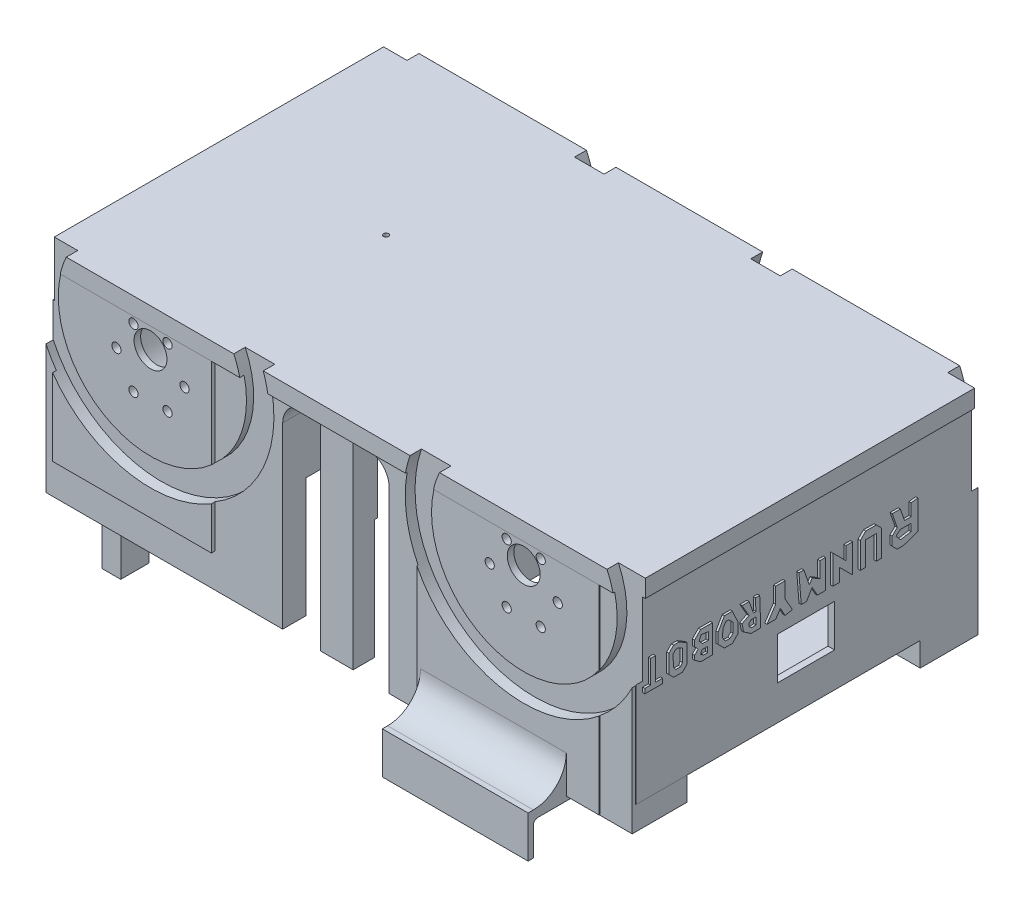
from build123d import *

# Parameters (mm, degrees)
MOTORHOLDERS_DEPTH            = 80
MOTORHOLDERS_DEPTH_BACK       = 80
MOTORHOLDERSSKETCH_R          = 23.41
MOTORHOLDERS_2_DEPTH          = 80
MOTORHOLDERS_2_DEPTH_BACK     = 80
MOTORHOLDERSSKETCH_R_2        = 23.410000000000025
CUT_EXTRUDE1_DEPTH            = 26
POWERBANKHOLDERS_DEPTH        = 40
POWERBANKHOLDERS_DEPTH_BACK   = 59
SKETCH6_W                     = 107.48566634907709
SKETCH6_H                     = 13.420779118391124
SKETCH6_W_2                   = 20.81020685105895
SKETCH6_H_2                   = 2.0210586418158982
POWERBANKHOLDERS_2_DEPTH      = 40
POWERBANKHOLDERS_2_DEPTH_BACK = 59
SKETCH6_W_3                   = 107.81575088950635
SKETCH6_H_3                   = 38.261259505880204
SKETCH6_W_4                   = 10.842850570790063
SKETCH6_H_4                   = 10.34767934655001
POWERBANKHOLDERS_3_DEPTH      = 40
POWERBANKHOLDERS_3_DEPTH_BACK = 59
SKETCH6_W_5                   = 12.84432880492869
SKETCH6_H_5                   = 18.336479725004295
SKETCH6_W_6                   = 4.801433035453329
SKETCH6_H_6                   = 16.44346118779616
POWERBANKHOLDERS_4_DEPTH      = 40
POWERBANKHOLDERS_4_DEPTH_BACK = 59
SKETCH6_W_7                   = 11.134493860227579
SKETCH6_H_7                   = 18.035399163150785
POWERBANKHOLDERS_5_DEPTH      = 40
POWERBANKHOLDERS_5_DEPTH_BACK = 59
SKETCH6_W_8                   = 17.76333338604985
SKETCH6_H_8                   = 11.185766025079147
POWERBANKHOLDERS_6_DEPTH      = 40
POWERBANKHOLDERS_6_DEPTH_BACK = 59
SKETCH6_W_9                   = 14.81192900930138
SKETCH6_H_9                   = 11.030658463431195
POWERBANKHOLDERS_7_DEPTH      = 40
POWERBANKHOLDERS_7_DEPTH_BACK = 59
SKETCH6_W_10                  = 28.15049543841664
SKETCH6_H_10                  = 24.933985152667752
SKETCH6_W_11                  = 10.177859406913743
SKETCH6_H_11                  = 9.830705690674797
POWERBANKHOLDERS_8_DEPTH      = 40
POWERBANKHOLDERS_8_DEPTH_BACK = 59
SKETCH6_W_12                  = 9.898416254173764
SKETCH6_H_12                  = 10.635603546202077
BOTTOMPLATE_DEPTH             = 5
BOTTOMPLATE_DEPTH_BACK        = 3
SKETCH21_R                    = 156.39530567461404
SKETCH23_W                    = 82.93611580154447
SKETCH23_H                    = 96.21116390792395
MOTORMOUNTINGSUPPORT1_DEPTH   = 6
SKETCH24_W                    = 78.34199480159754
SKETCH24_H                    = 94.4397113557649
MOTORMOUNTINGSUPPOR2_DEPTH    = 6
SKETCH17_R                    = 2.09999999999999
SKETCH17_R_2                  = 7.500000000000012
MOTORHOLES1_DEPTH             = 31.5
SKETCH19_R                    = 2.09999999999999
SKETCH19_R_2                  = 7.500000000000012
CUT_EXTRUDE4_DEPTH            = 30
BOLTHOLESSKETCH3_R            = 2.099999999999999
BOLTHOLESSKETCH3_R_2          = 2.1000000000000005
BOLTHOLESSKETCH3_R_3          = 2.100000000000001
BOLTHOLESSKETCH3_R_4          = 2.1
BOLTHOLESSKETCH3_R_5          = 7.5
MOTORHOLES3_DEPTH             = 31.5
BOLTHOLESSKETCH4_R            = 2.1000000000000005
BOLTHOLESSKETCH4_R_2          = 2.100000000000001
BOLTHOLESSKETCH4_R_3          = 2.099999999999999
BOLTHOLESSKETCH4_R_4          = 2.1
BOLTHOLESSKETCH4_R_5          = 7.5
MOTORHOLES4_DEPTH             = 15
SKETCH29_W                    = 154.63520503595873
SKETCH29_H                    = 84.13158809310062
SKETCH29_W_2                  = 25.999999999999996
SKETCH29_H_2                  = 19.212652327723852
BOSS_EXTRUDE8_DEPTH           = 3
SKETCH27_W                    = 226.46009321955773
SKETCH27_H                    = 129.98521171532218
BOSS_EXTRUDE6_DEPTH           = 3
CELLPHONEPLATE_DEPTH          = 1.5
CELLPHONEPLATE_DEPTH_BACK     = 2.5
SKETCH28_W                    = 66.38711597502933
SKETCH28_H                    = 194.1164695368904
SKETCH40_W                    = 33.84157761105802
SKETCH40_H                    = 31.531825245394884
BOSS_EXTRUDE11_DEPTH          = 40.00000000000001
FILLET2_R                     = 15
FILLET3_R                     = 15
POWERBANKCUT_START            = -54.404272
POWERBANKCUT_DEPTH            = 54.404272
MOTORHOLDERCUT_DEPTH          = 77
MOTORHOLDERCUT_DEPTH_BACK     = 77
MOTORHOLDEREXTRUDESKETCH_R    = 20.414999999999996
MOTORHOLDEREXTRUDESKETCH_R_2  = 20.415
LABEL_DEPTH                   = 1
BASEDEFININGCUT_DEPTH         = 20
BASEDEFININGCUT_DEPTH_BACK    = 20
SKETCH32_W                    = 420.0455690375122
SKETCH32_H                    = 425.0465275567352
SKETCH32_W_2                  = 269.20567079458385
SKETCH32_H_2                  = 160.6451255561545
SKETCH36_R                    = 7.790164170832256
CUT_EXTRUDE6_DEPTH            = 40
SKETCH37_W                    = 55.34013361119605
SKETCH37_H                    = 29.77089050035886
CUT_EXTRUDE7_DEPTH            = 36
SKETCH38_R                    = 1.1451827740932787
CUT_EXTRUDE8_DEPTH            = 10
SPACEFORWHEEL1_DEPTH          = 10
SPACEFORWHEEL1_DEPTH_BACK     = 5
SKETCH41_R                    = 54.50000000000001
SKETCH41_R_2                  = 42
CUT_EXTRUDE10_DEPTH           = 10
CUT_EXTRUDE10_DEPTH_BACK      = 5
SKETCH42_R                    = 54.5
SKETCH42_R_2                  = 42
CUT_EXTRUDE11_DEPTH           = 10
CUT_EXTRUDE11_DEPTH_BACK      = 5
SKETCH43_R                    = 54.5
SKETCH43_R_2                  = 42
CUT_EXTRUDE12_DEPTH           = 10
CUT_EXTRUDE12_DEPTH_BACK      = 5
SKETCH44_R                    = 54.50000000000001
SKETCH44_R_2                  = 42
SKETCH45_W                    = 114.13753960277973
SKETCH45_H                    = 142.1470000344427
BACKPLATE_DEPTH               = 2
FILLET4_R                     = 15
FILLET5_R                     = 15
SKETCH47_W                    = 66.38711597502933
SKETCH47_H                    = 3.2790129923405544
SKETCH47_H_2                  = 2.4323307430051813
BOSS_EXTRUDE14_DEPTH          = 15
FILLET6_R                     = 2
FILLET7_R                     = 2
FILLET8_R                     = 10
FILLET9_R                     = 10
FILLET10_R                    = 10
FILLET11_R                    = 10
SKETCH50_W                    = 8.545792847575534
SKETCH50_H                    = 12.7585898723055
SKETCH50_W_2                  = 13.708152170310989
SKETCH50_H_2                  = 12.203436132949719
BOSS_EXTRUDE15_DEPTH          = 42.74272791


with BuildPart() as part:
    # MotorHoldersSketch → MotorHolders (new, two sides: drawn at the far end of the back side and taken through both)
    with BuildSketch(Plane.XY.offset(-MOTORHOLDERS_DEPTH_BACK)):
        Circle(MOTORHOLDERSSKETCH_R)
    extrude(amount=MOTORHOLDERS_DEPTH + MOTORHOLDERS_DEPTH_BACK)


with BuildPart() as body_2:
    # MotorHoldersSketch → MotorHolders 2 (new, two sides: drawn at the far end of the back side and taken through both)
    with BuildSketch(Plane.XY.offset(-MOTORHOLDERS_2_DEPTH_BACK)):
        with Locations((170, 0)):
            Circle(MOTORHOLDERSSKETCH_R_2)
    extrude(amount=MOTORHOLDERS_2_DEPTH + MOTORHOLDERS_2_DEPTH_BACK)


with BuildPart() as cut_extrude1_tool:
    # Sketch4 → Cut-Extrude1 (new body)
    with BuildSketch(Plane(origin=(0, 0, 0), x_dir=(1, 0, 0), z_dir=(0, 1, 0))):
        Polygon((221.28112037560754, -76.3794444337611), (-41.49386299775418, -76.37944443376111), (-41.49386299775418, 76.73310878075944), (221.28112037560754, 76.73310878075947), align=None)
    extrude(amount=-CUT_EXTRUDE1_DEPTH)


with BuildPart() as part_1:
    add(part.part)

    # Cut-Extrude1: cut by cut_extrude1_tool
    add(cut_extrude1_tool.part, mode=Mode.SUBTRACT)


with BuildPart() as body_2_1:
    add(body_2.part)

    # Cut-Extrude1: cut by cut_extrude1_tool
    add(cut_extrude1_tool.part, mode=Mode.SUBTRACT)


with BuildPart() as body_3:
    # Sketch6 → PowerBankHolders (new, two sides: drawn at the far end of the back side and taken through both)
    with BuildSketch(Plane(origin=(170, -34.82927212472651, 0), x_dir=(-1, 0, 0), z_dir=(0, -1, 0)).offset(-POWERBANKHOLDERS_DEPTH_BACK)):
        with Locations((165.84301336448004, 72.23860239394497)):
            Rectangle(SKETCH6_W, SKETCH6_H)
        with Locations((203.359863581841, 72.02584001471735)):
            Rectangle(SKETCH6_W_2, SKETCH6_H_2, mode=Mode.SUBTRACT)
    extrude(amount=POWERBANKHOLDERS_DEPTH + POWERBANKHOLDERS_DEPTH_BACK)



with BuildPart() as body_4:
    # Sketch6 → PowerBankHolders 2 (new, two sides: drawn at the far end of the back side and taken through both)
    with BuildSketch(Plane(origin=(170, -34.82927212472651, 0), x_dir=(-1, 0, 0), z_dir=(0, -1, 0)).offset(-POWERBANKHOLDERS_2_DEPTH_BACK)):
        with Locations((165.40685205589546, -59.15152226882369)):
            Rectangle(SKETCH6_W_3, SKETCH6_H_3)
        with Locations((206.51967237862002, -65.31428126840754)):
            Rectangle(SKETCH6_W_4, SKETCH6_H_4, mode=Mode.SUBTRACT)
    extrude(amount=POWERBANKHOLDERS_2_DEPTH + POWERBANKHOLDERS_2_DEPTH_BACK)


with BuildPart() as body_5:
    # Sketch6 → PowerBankHolders 3 (new, two sides: drawn at the far end of the back side and taken through both)
    with BuildSketch(Plane(origin=(170, -34.82927212472651, 0), x_dir=(-1, 0, 0), z_dir=(0, -1, 0)).offset(-POWERBANKHOLDERS_3_DEPTH_BACK)):
        Polygon((61.48912491997995, 77.86267405225546), (19.990361205501905, 77.86267405225546), (19.990361205501912, 40.75116664647993), (61.48912491997996, 40.75116664647993), align=None)
        with Locations((34.93306737058843, 60.0094908798372)):
            Rectangle(SKETCH6_W_5, SKETCH6_H_5, mode=Mode.SUBTRACT)
        with Locations((56.270377411507866, 59.54149533416331)):
            Rectangle(SKETCH6_W_6, SKETCH6_H_6, mode=Mode.SUBTRACT)
    extrude(amount=POWERBANKHOLDERS_3_DEPTH + POWERBANKHOLDERS_3_DEPTH_BACK)


with BuildPart() as body_6:
    # Sketch6 → PowerBankHolders 4 (new, two sides: drawn at the far end of the back side and taken through both)
    with BuildSketch(Plane(origin=(170, -34.82927212472651, 0), x_dir=(-1, 0, 0), z_dir=(0, -1, 0)).offset(-POWERBANKHOLDERS_4_DEPTH_BACK)):
        Polygon((61.848353672680666, -44.171562986971225), (20.085249497251212, -44.171562986971225), (20.08524949725122, -79.44365778120854), (61.84835367268067, -79.44365778120854), align=None)
        with Locations((37.739531579554786, -63.79239196585518)):
            Rectangle(SKETCH6_W_7, SKETCH6_H_7, mode=Mode.SUBTRACT)
        Polygon((56.36480368236718, -69.86379189792335), (51.71071499986879, -69.86379189792335), (51.71071499986879, -55.42725312023401), (56.36480368236718, -55.427253120234), align=None, mode=Mode.SUBTRACT)
    extrude(amount=POWERBANKHOLDERS_4_DEPTH + POWERBANKHOLDERS_4_DEPTH_BACK)


with BuildPart() as body_7:
    # Sketch6 → PowerBankHolders 5 (new, two sides: drawn at the far end of the back side and taken through both)
    with BuildSketch(Plane(origin=(170, -34.82927212472651, 0), x_dir=(-1, 0, 0), z_dir=(0, -1, 0)).offset(-POWERBANKHOLDERS_5_DEPTH_BACK)):
        with Locations((88.2978554425371, 73.35610894060096)):
            Rectangle(SKETCH6_W_8, SKETCH6_H_8)
    extrude(amount=POWERBANKHOLDERS_5_DEPTH + POWERBANKHOLDERS_5_DEPTH_BACK)


with BuildPart() as body_8:
    # Sketch6 → PowerBankHolders 6 (new, two sides: drawn at the far end of the back side and taken through both)
    with BuildSketch(Plane(origin=(170, -34.82927212472651, 0), x_dir=(-1, 0, 0), z_dir=(0, -1, 0)).offset(-POWERBANKHOLDERS_6_DEPTH_BACK)):
        with Locations((86.82215325416286, -72.7668227900482)):
            Rectangle(SKETCH6_W_9, SKETCH6_H_9)
    extrude(amount=POWERBANKHOLDERS_6_DEPTH + POWERBANKHOLDERS_6_DEPTH_BACK)


with BuildPart() as body_9:
    # Sketch6 → PowerBankHolders 7 (new, two sides: drawn at the far end of the back side and taken through both)
    with BuildSketch(Plane(origin=(170, -34.82927212472651, 0), x_dir=(-1, 0, 0), z_dir=(0, -1, 0)).offset(-POWERBANKHOLDERS_7_DEPTH_BACK)):
        with Locations((-34.77538877141884, -66.97666520487466)):
            Rectangle(SKETCH6_W_10, SKETCH6_H_10)
        with Locations((-36.725173704837744, -67.89473870209318)):
            Rectangle(SKETCH6_W_11, SKETCH6_H_11, mode=Mode.SUBTRACT)
    extrude(amount=POWERBANKHOLDERS_7_DEPTH + POWERBANKHOLDERS_7_DEPTH_BACK)


with BuildPart() as body_10:
    # Sketch6 → PowerBankHolders 8 (new, two sides: drawn at the far end of the back side and taken through both)
    with BuildSketch(Plane(origin=(170, -34.82927212472651, 0), x_dir=(-1, 0, 0), z_dir=(0, -1, 0)).offset(-POWERBANKHOLDERS_8_DEPTH_BACK)):
        Polygon((-18.387318432179, 77.86267405225546), (-49.058063184687306, 77.86267405225546), (-49.058063184687306, 51.53245449057575), (-18.387318432178997, 51.53245449057575), align=None)
        with Locations((-36.58545212846775, 63.85992896923831)):
            Rectangle(SKETCH6_W_12, SKETCH6_H_12, mode=Mode.SUBTRACT)
    extrude(amount=POWERBANKHOLDERS_8_DEPTH + POWERBANKHOLDERS_8_DEPTH_BACK)


with BuildPart() as body_3_1:
    add(body_3.part)

    add(body_4.part)  # BottomPlate merges body 4

    add(body_2_1.part)  # BottomPlate merges body 2

    add(part_1.part)  # BottomPlate merges part

    add(body_5.part)  # BottomPlate merges body 5

    add(body_6.part)  # BottomPlate merges body 6
    # Sketch21 → BottomPlate (add, two sides: drawn at the far end of the back side and taken through both)
    with BuildSketch(Plane(origin=(0, 19.57500000000001, 0), x_dir=(1, 0, 0), z_dir=(0, 1, 0)).offset(-BOTTOMPLATE_DEPTH_BACK)):
        with Locations(Location((85, 0, 0), (0, 0, 270))):
            Circle(SKETCH21_R)
    extrude(amount=BOTTOMPLATE_DEPTH + BOTTOMPLATE_DEPTH_BACK)


    add(body_9.part)  # MotorMountingSupport1 merges body 9
    # Sketch23 → MotorMountingSupport1 (add)
    with BuildSketch(Plane.XY.offset(80)):
        Polygon((27.741104921460646, -59.32285943157468), (-44.590126411037545, -59.32285943157469), (-44.590126411037545, 21.840194884099123), (27.741104921460646, 21.840194884099155), align=None)
        with Locations((162.78990640537927, -26.265387069862815)):
            Rectangle(SKETCH23_W, SKETCH23_H)
    extrude(amount=-MOTORMOUNTINGSUPPORT1_DEPTH)


    add(body_10.part)  # MotorMountingSuppor2 merges body 10
    # Sketch24 → MotorMountingSuppor2 (add)
    with BuildSketch(Plane(origin=(0, 0, -80), x_dir=(-1, 0, 0), z_dir=(0, 0, -1))):
        with Locations((-163.01952291155786, -27.98244879419265)):
            Rectangle(SKETCH24_W, SKETCH24_H)
        Polygon((-24.364188118497054, -64.15214262477775), (29.550487251242423, -64.15214262477775), (29.55048725124243, 22.52259734262907), (-24.364188118497054, 22.52259734262907), align=None)
    extrude(amount=-MOTORMOUNTINGSUPPOR2_DEPTH)

    # Sketch17 → MotorHoles1 (cut)
    with BuildSketch(Plane.XY.offset(80)):
        with Locations((185.5, 3.47e-15)):
            Circle(SKETCH17_R)
        with Locations((177.75000000000003, -13.42)):
            Circle(SKETCH17_R)
        with Locations((162.25, -13.420000000000002)):
            Circle(SKETCH17_R)
        with Locations((154.50000000000003, -9.5e-16)):
            Circle(SKETCH17_R)
        with Locations((162.25, 13.42)):
            Circle(SKETCH17_R)
        with Locations((177.75000000000003, 13.420000000000002)):
            Circle(SKETCH17_R)
        with Locations((170, 6.999999999999999)):
            Circle(SKETCH17_R_2)
    extrude(amount=-MOTORHOLES1_DEPTH, mode=Mode.SUBTRACT)

    # Sketch19 → Cut-Extrude4 (cut)
    with BuildSketch(Plane(origin=(0, 0, -80), x_dir=(-1, 0, 0), z_dir=(0, 0, -1))):
        with Locations(Location((-185.5, 3.47e-15, 0), (0, 0, 180))):
            Circle(SKETCH19_R)
        with Locations(Location((-177.75000000000003, -13.42, 0), (0, 0, 180))):
            Circle(SKETCH19_R)
        with Locations(Location((-162.25, -13.420000000000002, 0), (0, 0, 180))):
            Circle(SKETCH19_R)
        with Locations(Location((-154.50000000000003, -9.5e-16, 0), (0, 0, 180))):
            Circle(SKETCH19_R)
        with Locations(Location((-162.25, 13.42, 0), (0, 0, 180))):
            Circle(SKETCH19_R)
        with Locations(Location((-177.75000000000003, 13.420000000000002, 0), (0, 0, 180))):
            Circle(SKETCH19_R)
        with Locations(Location((-170, 6.999999999999999, 0), (0, 0, 180))):
            Circle(SKETCH19_R_2)
    extrude(amount=-CUT_EXTRUDE4_DEPTH, mode=Mode.SUBTRACT)

    # BoltHolesSketch3 → MotorHoles3 (cut)
    with BuildSketch(Plane.XY.offset(80)):
        with Locations((7.750000000000002, -13.419999999999996)):
            Circle(BOLTHOLESSKETCH3_R)
        with Locations((15.5, 9.5e-16)):
            Circle(BOLTHOLESSKETCH3_R_2)
        with Locations((7.75, 13.420000000000002)):
            Circle(BOLTHOLESSKETCH3_R_3)
        with Locations((-7.75, 13.419999999999996)):
            Circle(BOLTHOLESSKETCH3_R_4)
        with Locations((-15.5, -2.85e-15)):
            Circle(BOLTHOLESSKETCH3_R_2)
        with Locations((-7.749999999999998, -13.420000000000002)):
            Circle(BOLTHOLESSKETCH3_R_3)
        with Locations((0, 7.000000000000001)):
            Circle(BOLTHOLESSKETCH3_R_5)
    extrude(amount=-MOTORHOLES3_DEPTH, mode=Mode.SUBTRACT)

    # BoltHolesSketch4 → MotorHoles4 (cut)
    with BuildSketch(Plane(origin=(0, 0, -80), x_dir=(-1, 0, 0), z_dir=(0, 0, -1))):
        with Locations(Location((-15.5, 9.5e-16, 0), (0, 0, 180))):
            Circle(BOLTHOLESSKETCH4_R)
        with Locations(Location((-7.75, 13.420000000000002, 0), (0, 0, 180))):
            Circle(BOLTHOLESSKETCH4_R_2)
        with Locations(Location((7.75, 13.419999999999996, 0), (0, 0, 180))):
            Circle(BOLTHOLESSKETCH4_R_2)
        with Locations(Location((15.5, -2.85e-15, 0), (0, 0, 180))):
            Circle(BOLTHOLESSKETCH4_R)
        with Locations(Location((7.749999999999998, -13.420000000000002, 0), (0, 0, 180))):
            Circle(BOLTHOLESSKETCH4_R_3)
        with Locations(Location((-7.750000000000002, -13.419999999999996, 0), (0, 0, 180))):
            Circle(BOLTHOLESSKETCH4_R_4)
        with Locations(Location((0, 7.000000000000001, 0), (0, 0, 180))):
            Circle(BOLTHOLESSKETCH4_R_5)
    extrude(amount=-MOTORHOLES4_DEPTH, mode=Mode.SUBTRACT)

    # Sketch29 → Boss-Extrude8 (add)
    with BuildSketch(Plane(origin=(219.0580631846873, 0, 0), x_dir=(0, 0, -1), z_dir=(1, 0, 0))):
        with Locations((-0.6220853119600633, -21.859578751275425)):
            Rectangle(SKETCH29_W, SKETCH29_H)
        with Locations((-0.4507126701493025, -38.546737855057245)):
            Rectangle(SKETCH29_W_2, SKETCH29_H_2, mode=Mode.SUBTRACT)
    extrude(amount=-BOSS_EXTRUDE8_DEPTH)

    # Sketch27 → Boss-Extrude6 (add)
    with BuildSketch(Plane(origin=(0, 16.57500000000001, 0), x_dir=(-1, 0, 0), z_dir=(0, -1, 0))):
        with Locations((-81.59637652194363, -0.4409200767696575)):
            Rectangle(SKETCH27_W, SKETCH27_H)
    extrude(amount=-BOSS_EXTRUDE6_DEPTH)

    # Sketch28 → CellPhonePlate (add, two sides: drawn at the far end of the back side and taken through both)
    with BuildSketch(Plane(origin=(0, -74.82927212472651, 0), x_dir=(-1, 0, 0), z_dir=(0, -1, 0)).offset(-CELLPHONEPLATE_DEPTH_BACK)):
        with Locations((-156.1961547289368, -0.33906712376997206)):
            Rectangle(SKETCH28_W, SKETCH28_H)
    extrude(amount=CELLPHONEPLATE_DEPTH + CELLPHONEPLATE_DEPTH_BACK)

    # Sketch40 → Boss-Extrude11 (add)
    with BuildSketch(Plane.XZ.offset(-16.57500000000001)):
        with Locations((-32.665057733489554, -49.76230021205197)):
            Rectangle(SKETCH40_W, SKETCH40_H)
    extrude(amount=BOSS_EXTRUDE11_DEPTH)

    # Fillet2
    fillet2_edges = [body_3_1.edges().sort_by_distance(p)[0] for p in [
        (-33.058778866481674, 16.57500000000001, -33.996387589354526),
    ]]
    fillet(fillet2_edges, radius=FILLET2_R)

    # Fillet3
    fillet3_edges = [body_3_1.edges().sort_by_distance(p)[0] for p in [
        (-32.66505773348956, -23.424999999999997, -65.52821283474941),
    ]]
    fillet(fillet3_edges, radius=FILLET3_R)


with BuildPart() as powerbankcut_tool:
    # Sketch11 → PowerBankCut (new body)
    with BuildSketch(Plane(origin=(0, -20.42499999999999, 0), x_dir=(1, 0, 0), z_dir=(0, 1, 0)).offset(POWERBANKCUT_START)):
        Polygon((-34.21619001805881, -64.75806101125161), (-34.21619001805884, 73.34245994628247), (204.21619001805877, 63.61100877966222), (204.2161900180588, -72.19540771469299), align=None)
    extrude(amount=POWERBANKCUT_DEPTH)


with BuildPart() as body_3_2:
    add(body_3_1.part)

    # PowerBankCut: cut by powerbankcut_tool
    add(powerbankcut_tool.part, mode=Mode.SUBTRACT)

    # MotorHolderExtrudeSketch → MotorHolderCut (cut, two sides: drawn at the far end of the back side and taken through both)
    with BuildSketch(Plane.XY.offset(-MOTORHOLDERCUT_DEPTH_BACK)):
        with Locations((170, 0)):
            Circle(MOTORHOLDEREXTRUDESKETCH_R)
        Circle(MOTORHOLDEREXTRUDESKETCH_R_2)
    extrude(amount=MOTORHOLDERCUT_DEPTH + MOTORHOLDERCUT_DEPTH_BACK, mode=Mode.SUBTRACT)

    # Sketch31 → Label (add)
    # profile 1 of 10: a face of its own
    with BuildSketch(Plane(origin=(219.0580631846873, 0, 0), x_dir=(0, 0, -1), z_dir=(1, 0, 0))):
        Polygon((49.44174371046017, -6.1927274537474375), (49.44174371046017, -19.373871934025303), (42.93424084605138, -21.63408214880746), (40.061775133750494, -21.634082148807504), (37.78633028731438, -19.358637302371353), (37.78633028731443, -15.3813488393304), (40.06177513375064, -13.105903992894131), (37.78633028731434, -6.554538213222343), (41.49800798990039, -6.554538213222341), (43.400438847655955, -12.03193769368495), (46.38900489695175, -12.03193769368495), (46.38900489695175, -6.554538213222341), align=None)
        Polygon((46.38900489695175, -17.885685431779123), (46.38900489695175, -14.591500132271438), (41.498007989901, -14.591500132271438), (39.50668952735725, -16.25408163044397), (41.56556386704593, -18.720050660645562), align=None, mode=Mode.SUBTRACT)
    # profile 2 of 10: a face of its own
    with BuildSketch(Plane(origin=(219.0580631846873, 0, 0), x_dir=(0, 0, -1), z_dir=(1, 0, 0))):
        Polygon((33.01927921206982, -21.634082148807465), (33.01927921206977, -9.830221103058387), (30.540166598312304, -7.3511084893009615), (25.72029726313477, -7.351108489300948), (23.241184649377374, -9.830221103058344), (23.241184649377377, -21.634082148807465), (25.72029726313474, -21.634082148807465), (25.72029726313474, -10.745357896500142), (30.540166598312936, -10.745357896500142), (30.540166598312975, -21.634082148807465), align=None)
    # profile 3 of 10: a face of its own
    with BuildSketch(Plane(origin=(219.0580631846873, 0, 0), x_dir=(0, 0, -1), z_dir=(1, 0, 0))):
        Polygon((19.72261369795092, -8.590664796179631), (19.72261369795092, -21.634082148807465), (13.820683175076207, -15.732151625932902), (13.820683175076207, -21.634082148807465), (10.770813100421606, -21.634082148807465), (10.770813100421606, -8.590664796179631), (16.771648436513566, -14.591500132271438), (16.771648436513566, -8.590664796179631), align=None)
    # profile 4 of 10: a face of its own
    with BuildSketch(Plane(origin=(219.0580631846873, 0, 0), x_dir=(0, 0, -1), z_dir=(1, 0, 0))):
        Polygon((7.389109220255818, -8.590664796179631), (7.389109220255828, -21.634082148807455), (3.728231083885912, -21.634082148807455), (1.3209222130919491, -17.369993070850853), (-1.2519341028614182, -21.634082148807465), (-3.655389162432243, -21.634082148807465), (-4.691643116814248, -8.590664796179631), (-2.453661632646831, -8.590664796179631), (0.03449405511526563, -15.754458747428295), (1.3209222130919493, -13.622414208449989), (4.8544377755440635, -15.754458747428295), (4.8544377755440635, -8.590664796179631), align=None)
    # profile 5 of 10: a face of its own
    with BuildSketch(Plane(origin=(219.0580631846873, 0, 0), x_dir=(0, 0, -1), z_dir=(1, 0, 0))):
        Polygon((-7.682306608131739, -21.634082148807465), (-10.987514090928132, -15.754458747428295), (-10.98751409092813, -8.590664796179631), (-15.310206687800587, -8.590664796179631), (-15.310206687800587, -15.754458747428295), (-19.269516545463716, -21.634082148807465), (-15.310206687800587, -21.634082148807465), (-13.148860389364359, -18.42445654949396), (-10.98751409092813, -22.269268816474032), align=None)
    # profile 6 of 10: a face of its own
    with BuildSketch(Plane(origin=(219.0580631846873, 0, 0), x_dir=(0, 0, -1), z_dir=(1, 0, 0))):
        Polygon((-22.571010895873655, -8.590664796179631), (-22.09891941613762, -21.634082148807465), (-26.49150978726313, -21.634082148807465), (-29.911637517145095, -19.358637302371307), (-30.6359969112963, -15.754458747428295), (-27.413487688704663, -14.10521215880678), (-30.6359969112963, -8.590664796179631), (-27.413487688704663, -8.590664796179631), (-25.39872089464268, -14.10521215880678), (-24.295214601700366, -14.10521215880678), (-24.49480729693622, -8.590664796179631), align=None)
        Polygon((-24.295214601700366, -19.358637302371307), (-24.295214601700366, -16.25408163044397), (-26.49150978726313, -16.25408163044397), (-27.413487688704663, -17.176059531885507), (-27.413487688704663, -18.42445654949396), (-26.333852081844896, -19.50409215635372), align=None, mode=Mode.SUBTRACT)
    # profile 7 of 10: a face of its own
    with BuildSketch(Plane(origin=(219.0580631846873, 0, 0), x_dir=(0, 0, -1), z_dir=(1, 0, 0))):
        Polygon((-35.009913232585205, -8.590664796179631), (-38.63945615178467, -8.590664796179631), (-41.524071595901546, -13.622414208449989), (-41.524071595901546, -18.42445654949396), (-38.63945615178466, -21.309071993610758), (-35.00991323258518, -21.309071993610758), (-32.49783927776888, -18.796998038794143), (-32.49783927776889, -14.10521215880738), align=None)
        Polygon((-36.1114150574906, -18.796998038793785), (-34.718122354746654, -17.403705336049832), (-34.718122354746654, -13.105903992894156), (-36.6627046432395, -11.16132170440131), (-37.865915536187345, -11.16132170440131), (-39.31071825670074, -13.105903992894156), (-39.51545465186257, -16.8543770928693), (-38.250007481451576, -18.720050660645562), align=None, mode=Mode.SUBTRACT)
    # profile 8 of 10: a face of its own
    with BuildSketch(Plane(origin=(219.0580631846873, 0, 0), x_dir=(0, 0, -1), z_dir=(1, 0, 0))):
        Polygon((-44.05929199650416, -21.309071993610758), (-44.05929199650416, -8.590664796179631), (-49.44994372624463, -8.590664796179652), (-52.2269470949443, -11.367668164879333), (-52.2269470949443, -14.105212158806895), (-50.577700506322884, -15.754458747428295), (-52.22694709494441, -17.403705336049832), (-52.22694709494441, -19.358637302371307), (-49.44994372624478, -21.309071993610758), align=None)
        Polygon((-46.24361075708805, -16.8543770928693), (-48.9031660929129, -16.8543770928693), (-49.44994372624478, -18.42445654949396), (-48.08356754475085, -19.358637302371307), (-46.24361075708805, -19.358637302371307), align=None, mode=Mode.SUBTRACT)
        Polygon((-45.92060415559729, -14.591500132271438), (-45.92060415559729, -11.16132170440131), (-49.210466936372654, -10.745357896500142), (-50.17561703348861, -12.876410918336374), (-48.58914421049576, -14.591500132271438), align=None, mode=Mode.SUBTRACT)
    # profile 9 of 10: a face of its own
    with BuildSketch(Plane(origin=(219.0580631846873, 0, 0), x_dir=(0, 0, -1), z_dir=(1, 0, 0))):
        Polygon((-57.79766068057768, -21.309071993610758), (-55.60105831995572, -19.112469632988788), (-55.60105831995572, -10.745357896500142), (-59.26372900606225, -8.590664796179631), (-61.7817711138855, -8.590664796179631), (-63.936464214206, -10.745357896500142), (-63.936464214206, -19.112469632988788), (-61.7817711138855, -21.26716273330928), align=None)
        Polygon((-58.567152612369, -18.720050660645562), (-57.79766068057768, -17.403705336049832), (-57.79766068057768, -11.763595565760454), (-59.65727085684591, -10.745357896500142), (-60.81444781894163, -10.745357896500142), (-62.10102761612644, -12.03193769368495), (-61.7817711138855, -17.403705336049832), (-60.81444781894163, -18.720050660645562), align=None, mode=Mode.SUBTRACT)
    # profile 10 of 10: a face of its own
    with BuildSketch(Plane(origin=(219.0580631846873, 0, 0), x_dir=(0, 0, -1), z_dir=(1, 0, 0))):
        Polygon((-66.79176795681485, -21.26716273330928), (-74.87053179880832, -21.26716273330928), (-74.87053179880832, -19.112469632988788), (-72.26647729210356, -19.112469632988788), (-72.26647729210356, -8.590664796179631), (-69.99768423602859, -8.590664796179631), (-69.99768423602859, -19.112469632988788), (-66.79176795681485, -19.112469632988788), align=None)
    extrude(amount=LABEL_DEPTH)

    # Sketch32 → BaseDefiningCut (cut, two sides: drawn at the far end of the back side and taken through both)
    with BuildSketch(Plane(origin=(0, 19.57500000000001, 0), x_dir=(1, 0, 0), z_dir=(0, 1, 0)).offset(-BASEDEFININGCUT_DEPTH_BACK)):
        with Locations((73.53385003987967, -6.203492346204442)):
            Rectangle(SKETCH32_W, SKETCH32_H)
        with Locations((85.78915811400735, 0.10756308712167595)):
            Rectangle(SKETCH32_W_2, SKETCH32_H_2, mode=Mode.SUBTRACT)
    extrude(amount=BASEDEFININGCUT_DEPTH + BASEDEFININGCUT_DEPTH_BACK, mode=Mode.SUBTRACT)

    # Sketch36 → Cut-Extrude6 (cut)
    with BuildSketch(Plane.ZY.offset(49.31472750064861)):
        with Locations((49.3821520217638, -38.36887933889721)):
            Circle(SKETCH36_R)
    extrude(amount=-CUT_EXTRUDE6_DEPTH, mode=Mode.SUBTRACT)

    # Sketch37 → Cut-Extrude7 (cut)
    with BuildSketch(Plane.XZ.offset(20.42499999999999)):
        with Locations((116.74597854070612, -50.55835480792048)):
            Rectangle(SKETCH37_W, SKETCH37_H)
    extrude(amount=-CUT_EXTRUDE7_DEPTH, mode=Mode.SUBTRACT)

    # Sketch38 → Cut-Extrude8 (cut)
    with BuildSketch(Plane.XZ.offset(-16.57500000000001)):
        with Locations(Location((25.996445740276545, -1.3164980151699213, 0), (0, 0, 270))):
            Circle(SKETCH38_R)
    extrude(amount=-CUT_EXTRUDE8_DEPTH, mode=Mode.SUBTRACT)

    # Sketch41 → SpaceForWheel1 (cut, two sides: drawn at the far end of the back side and taken through both)
    with BuildSketch(Plane.XY.offset(80).offset(-SPACEFORWHEEL1_DEPTH_BACK)):
        with Locations((0, 7.000000000000001)):
            Circle(SKETCH41_R)
        with Locations((0, 7.000000000000001)):
            Circle(SKETCH41_R_2, mode=Mode.SUBTRACT)
    extrude(amount=SPACEFORWHEEL1_DEPTH + SPACEFORWHEEL1_DEPTH_BACK, mode=Mode.SUBTRACT)

    # Sketch42 → Cut-Extrude10 (cut, two sides: drawn at the far end of the back side and taken through both)
    with BuildSketch(Plane.XY.offset(80).offset(-CUT_EXTRUDE10_DEPTH_BACK)):
        with Locations((170, 6.999999999999999)):
            Circle(SKETCH42_R)
        with Locations((170, 6.999999999999999)):
            Circle(SKETCH42_R_2, mode=Mode.SUBTRACT)
    extrude(amount=CUT_EXTRUDE10_DEPTH + CUT_EXTRUDE10_DEPTH_BACK, mode=Mode.SUBTRACT)

    # Sketch43 → Cut-Extrude11 (cut, two sides: drawn at the far end of the back side and taken through both)
    with BuildSketch(Plane(origin=(0, 0, -80), x_dir=(-1, 0, 0), z_dir=(0, 0, -1)).offset(-CUT_EXTRUDE11_DEPTH_BACK)):
        with Locations((-170, 6.999999999999999)):
            Circle(SKETCH43_R)
        with Locations((-170, 6.999999999999999)):
            Circle(SKETCH43_R_2, mode=Mode.SUBTRACT)
    extrude(amount=CUT_EXTRUDE11_DEPTH + CUT_EXTRUDE11_DEPTH_BACK, mode=Mode.SUBTRACT)

    # Sketch44 → Cut-Extrude12 (cut, two sides: drawn at the far end of the back side and taken through both)
    with BuildSketch(Plane(origin=(0, 0, -80), x_dir=(-1, 0, 0), z_dir=(0, 0, -1)).offset(-CUT_EXTRUDE12_DEPTH_BACK)):
        with Locations((0, 7.000000000000001)):
            Circle(SKETCH44_R)
        with Locations((0, 7.000000000000001)):
            Circle(SKETCH44_R_2, mode=Mode.SUBTRACT)
    extrude(amount=CUT_EXTRUDE12_DEPTH + CUT_EXTRUDE12_DEPTH_BACK, mode=Mode.SUBTRACT)

    # Sketch45 → BackPlate (add)
    with BuildSketch(Plane.ZY.offset(48.81367728328456)):
        with Locations((-15.037538426611263, -46.49850001722133)):
            Rectangle(SKETCH45_W, SKETCH45_H)
    extrude(amount=-BACKPLATE_DEPTH)

    # Fillet4
    fillet4_edges = [body_3_2.edges().sort_by_distance(p)[0] for p in [
        (156.1961547289368, -72.32927212472651, 80),
    ]]
    fillet(fillet4_edges, radius=FILLET4_R)

    # Fillet5
    fillet5_edges = [body_3_2.edges().sort_by_distance(p)[0] for p in [
        (156.61911911360528, -72.32927212472651, -80),
    ]]
    fillet(fillet5_edges, radius=FILLET5_R)

    # Sketch47 → Boss-Extrude14 (add)
    with BuildSketch(Plane.XZ.offset(76.32927212472651)):
        with Locations((156.1961547289368, -95.07966114850495)):
            Rectangle(SKETCH47_W, SKETCH47_H)
        with Locations((156.1961547289368, 96.18113652071258)):
            Rectangle(SKETCH47_W, SKETCH47_H_2)
    extrude(amount=BOSS_EXTRUDE14_DEPTH)

    # Fillet6
    fillet6_edges = [body_3_2.edges().sort_by_distance(p)[0] for p in [
        (156.1961547289368, -76.32927212472651, -93.44015465233468),
    ]]
    fillet(fillet6_edges, radius=FILLET6_R)

    # Fillet7
    fillet7_edges = [body_3_2.edges().sort_by_distance(p)[0] for p in [
        (156.1961547289368, -76.32927212472651, 94.96497114920999),
    ]]
    fillet(fillet7_edges, radius=FILLET7_R)

    # Fillet8
    fillet8_edges = [body_3_2.edges().sort_by_distance(p)[0] for p in [
        (57.89981981005852, 16.57500000000001, -72.23860239394497),
    ]]
    fillet(fillet8_edges, radius=FILLET8_R)

    # Fillet9
    fillet9_edges = [body_3_2.edges().sort_by_distance(p)[0] for p in [
        (108.51087508002004, 16.575000000000017, -59.306920349367694),
    ]]
    fillet(fillet9_edges, radius=FILLET9_R - 0.0001)  # a hair under: the kernel refuses the full size

    # Fillet10
    fillet10_edges = [body_3_2.edges().sort_by_distance(p)[0] for p in [
        (108.15164632731933, 16.575000000000017, 61.807610384089884),
    ]]
    fillet(fillet10_edges, radius=FILLET10_R)

    # Fillet11
    fillet11_edges = [body_3_2.edges().sort_by_distance(p)[0] for p in [
        (58.50102338885773, 16.57500000000001, 59.15152226882369),
    ]]
    fillet(fillet11_edges, radius=FILLET11_R)

    # Sketch50 → Boss-Extrude15 (add)
    with BuildSketch(Plane.XZ.offset(74.82927212472651)):
        with Locations((-45.041831076860845, 46.400187452036334)):
            Rectangle(SKETCH50_W, SKETCH50_H)
        with Locations((-42.73177045386308, -71.62993090122427)):
            Rectangle(SKETCH50_W_2, SKETCH50_H_2)
    extrude(amount=BOSS_EXTRUDE15_DEPTH)


with BuildPart() as body_7_1:
    add(body_7.part)

    # PowerBankCut: cut by powerbankcut_tool
    add(powerbankcut_tool.part, mode=Mode.SUBTRACT)


with BuildPart() as body_8_1:
    add(body_8.part)

    # PowerBankCut: cut by powerbankcut_tool
    add(powerbankcut_tool.part, mode=Mode.SUBTRACT)


solid = Compound([body_3_2.part, body_7_1.part, body_8_1.part])
